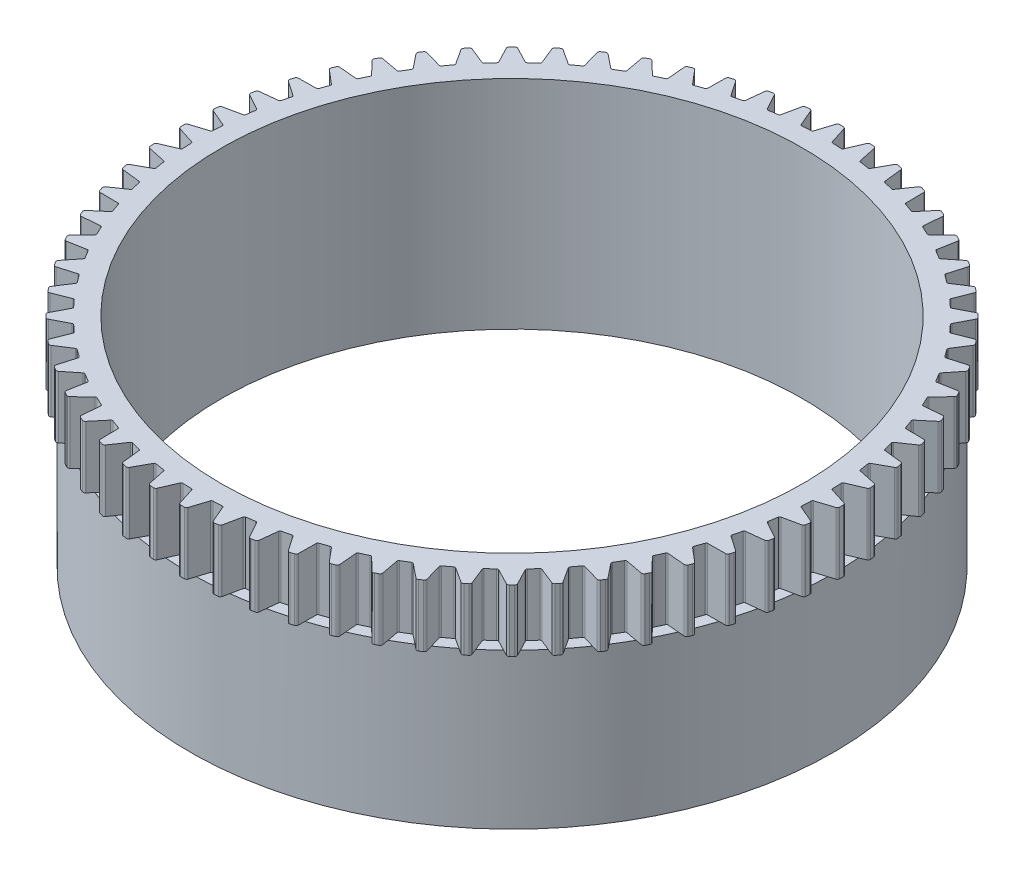
from build123d import *

# Parameters (mm, degrees)
BOSS_EXTRUDE1_DEPTH     = 8
SKETCH2_R               = 41.5
BOSS_EXTRUDE2_DEPTH     = 20
CUT_EXTRUDE1_DEPTH      = 67.306108316
CUT_EXTRUDE1_DEPTH_BACK = 67.306108316
SKETCH3_R               = 37.5


with BuildPart() as part:
    # Sketch1 → Boss-Extrude1 (new body)
    with BuildSketch(Plane(origin=(0, 0, 0), x_dir=(1, 0, 0), z_dir=(0, 1, 0))):
        with BuildLine():
            Line((-0.516428445, 42.290788925), (-1.207230425, 40.115163336))
            ThreePointArc((-1.207230425, 40.115163336), (-1.276964086, 40.016359136), (-1.390897576, 39.975810235))
            ThreePointArc((-1.390897576, 39.975810235), (-1.962706973, 39.951818248), (-2.534114577, 39.919647585))
            ThreePointArc((-2.534114577, 39.919647585), (-2.651473934, 39.948833797), (-2.730556314, 40.040327134))
            Line((-2.730556314, 40.040327134), (-3.631280492, 42.137766057))
            ThreePointArc((-3.631280492, 42.137766057), (-3.754372708, 42.277698039), (-3.936342379, 42.317943441))
            Line((-3.936342379, 42.317943441), (-4.395114549, 42.272758326))
            ThreePointArc((-4.395114549, 42.272758326), (-4.565736235, 42.197785707), (-4.659163894, 42.036528378))
            Line((-4.659163894, 42.036528378), (-5.133390874, 39.803668586))
            ThreePointArc((-5.133390874, 39.803668586), (-5.193104244, 39.698505061), (-5.302514626, 39.646983979))
            ThreePointArc((-5.302514626, 39.646983979), (-5.869218978, 39.567060399), (-6.434721822, 39.479036907))
            ThreePointArc((-6.434721822, 39.479036907), (-6.55437681, 39.49657935), (-6.642046302, 39.579880693))
            Line((-6.642046302, 39.579880693), (-7.744018213, 41.578933466))
            ThreePointArc((-7.744018213, 41.578933466), (-7.880233439, 41.706126491), (-8.065271615, 41.728341953))
            Line((-8.065271615, 41.728341953), (-8.517405756, 41.638406881))
            ThreePointArc((-8.517405756, 41.638406881), (-8.679857251, 41.547071426), (-8.757029047, 41.377433083))
            Line((-8.757029047, 41.377433083), (-9.010113964, 39.108842749))
            ThreePointArc((-9.010113964, 39.108842749), (-9.059231969, 38.998332681), (-9.163065561, 38.936335594))
            ThreePointArc((-9.163065561, 38.936335594), (-9.719207196, 38.801250128), (-10.273359178, 38.658221521))
            ThreePointArc((-10.273359178, 38.658221521), (-10.394157455, 38.663951254), (-10.489569754, 38.738258365))
            Line((-10.489569754, 38.738258365), (-11.782176804, 40.619673017))
            ThreePointArc((-11.782176804, 40.619673017), (-11.930203214, 40.732902146), (-12.116527877, 40.736873722))
            Line((-12.116527877, 40.736873722), (-12.55766969, 40.603054816))
            ThreePointArc((-12.55766969, 40.603054816), (-12.710386496, 40.496236135), (-12.770559223, 40.319850488))
            Line((-12.770559223, 40.319850488), (-12.80006473, 38.037377376))
            ThreePointArc((-12.80006473, 38.037377376), (-12.838114338, 37.922585038), (-12.935371166, 37.850709013))
            ThreePointArc((-12.935371166, 37.850709013), (-13.475594136, 37.661762607), (-14.01305847, 37.46510633))
            ThreePointArc((-14.01305847, 37.46510633), (-14.133836682, 37.458968171), (-14.236072915, 37.523565432))
            Line((-14.236072915, 37.523565432), (-15.706866593, 39.269222912))
            ThreePointArc((-15.706866593, 39.269222912), (-15.86527861, 39.367397686), (-16.051095352, 39.353087127))
            Line((-16.051095352, 39.353087127), (-16.476996399, 39.176673137))
            ThreePointArc((-16.476996399, 39.176673137), (-16.618507771, 39.055399952), (-16.661101934, 38.873965692))
            Line((-16.661101934, 38.873965692), (-16.466743876, 36.599591267))
            ThreePointArc((-16.466743876, 36.599591267), (-16.493358648, 36.481622172), (-16.583102075, 36.400559413))
            ThreePointArc((-16.583102075, 36.400559413), (-17.102203737, 36.159571725), (-17.617804348, 35.911181684))
            ThreePointArc((-17.617804348, 35.911181684), (-17.737399335, 35.893234747), (-17.845474911, 35.947500052))
            Line((-17.845474911, 35.947500052), (-19.48029067, 37.540588723))
            ThreePointArc((-19.48029067, 37.540588723), (-19.647562701, 37.622763666), (-19.831082004, 37.59030879))
            Line((-19.831082004, 37.59030879), (-20.237640627, 37.372998679))
            ThreePointArc((-20.237640627, 37.372998679), (-20.366583731, 37.238438918), (-20.391189124, 37.053703355))
            Line((-20.391189124, 37.053703355), (-19.974839276, 34.809331086))
            ThreePointArc((-19.974839276, 34.809331086), (-19.989762898, 34.68932134), (-20.071128646, 34.599852527))
            ThreePointArc((-20.071128646, 34.599852527), (-20.564109768, 34.3091444), (-21.052881139, 34.011412728))
            ThreePointArc((-21.052881139, 34.011412728), (-21.170141136, 33.981829851), (-21.283015229, 34.025240595))
            Line((-21.283015229, 34.025240595), (-23.066108899, 35.450418143))
            ThreePointArc((-23.066108899, 35.450418143), (-23.240630022, 35.515801865), (-23.420084495, 35.465515232))
            Line((-23.420084495, 35.465515232), (-23.803385311, 35.209401814))
            ThreePointArc((-23.803385311, 35.209401814), (-23.918518357, 35.062851361), (-23.924898017, 34.8765936))
            Line((-23.924898017, 34.8765936), (-23.290566055, 32.683838018))
            ThreePointArc((-23.290566055, 32.683838018), (-23.293654803, 32.562943381), (-23.365859276, 32.465930147))
            ThreePointArc((-23.365859276, 32.465930147), (-23.82797218, 32.128301259), (-24.285207176, 31.784095274))
            ThreePointArc((-24.285207176, 31.784095274), (-24.399002905, 31.743161358), (-24.515588475, 31.775299471))
            Line((-24.515588475, 31.775299471), (-26.42978789, 33.018840657))
            ThreePointArc((-26.42978789, 33.018840657), (-26.609877371, 33.066803477), (-26.78353877, 32.999169373))
            Line((-26.78353877, 32.999169373), (-27.139890384, 32.706719162))
            ThreePointArc((-27.139890384, 32.706719162), (-27.240104575, 32.549589378), (-27.228197062, 32.363603183))
            Line((-27.228197062, 32.363603183), (-26.381991951, 30.243581723))
            ThreePointArc((-26.381991951, 30.243581723), (-26.37321608, 30.122966477), (-26.435563908, 30.019343112))
            ThreePointArc((-26.435563908, 30.019343112), (-26.862358194, 29.638045014), (-27.283653392, 29.250679609))
            ThreePointArc((-27.283653392, 29.250679609), (-27.392888939, 29.198788868), (-27.512063203, 29.219344843))
            Line((-27.512063203, 29.219344843), (-29.538933575, 30.269273686))
            ThreePointArc((-29.538933575, 30.269273686), (-29.722857055, 30.299353696), (-29.889052926, 30.215023475))
            Line((-29.889052926, 30.215023475), (-30.215023475, 29.889052926))
            ThreePointArc((-30.215023475, 29.889052926), (-30.299353696, 29.722857055), (-30.269273686, 29.538933575))
            Line((-30.269273686, 29.538933575), (-29.219344843, 27.512063203))
            ThreePointArc((-29.219344843, 27.512063203), (-29.198788868, 27.392888939), (-29.250679609, 27.283653392))
            ThreePointArc((-29.250679609, 27.283653392), (-29.638045014, 26.862358194), (-30.019343112, 26.435563908))
            ThreePointArc((-30.019343112, 26.435563908), (-30.122966477, 26.37321608), (-30.243581723, 26.381991951))
            Line((-30.243581723, 26.381991951), (-32.363603183, 27.228197062))
            ThreePointArc((-32.363603183, 27.228197062), (-32.549589378, 27.240104575), (-32.706719162, 27.139890384))
            Line((-32.706719162, 27.139890384), (-32.999169373, 26.78353877))
            ThreePointArc((-32.999169373, 26.78353877), (-33.066803477, 26.609877371), (-33.018840657, 26.42978789))
            Line((-33.018840657, 26.42978789), (-31.775299471, 24.515588475))
            ThreePointArc((-31.775299471, 24.515588475), (-31.743161358, 24.399002905), (-31.784095274, 24.285207176))
            ThreePointArc((-31.784095274, 24.285207176), (-32.128301259, 23.82797218), (-32.465930147, 23.365859276))
            ThreePointArc((-32.465930147, 23.365859276), (-32.562943381, 23.293654803), (-32.683838018, 23.290566055))
            Line((-32.683838018, 23.290566055), (-34.8765936, 23.924898017))
            ThreePointArc((-34.8765936, 23.924898017), (-35.062851361, 23.918518357), (-35.209401814, 23.803385311))
            Line((-35.209401814, 23.803385311), (-35.465515232, 23.420084495))
            ThreePointArc((-35.465515232, 23.420084495), (-35.515801865, 23.240630022), (-35.450418143, 23.066108899))
            Line((-35.450418143, 23.066108899), (-34.025240595, 21.283015229))
            ThreePointArc((-34.025240595, 21.283015229), (-33.981829851, 21.170141136), (-34.011412728, 21.052881139))
            ThreePointArc((-34.011412728, 21.052881139), (-34.3091444, 20.564109768), (-34.599852527, 20.071128646))
            ThreePointArc((-34.599852527, 20.071128646), (-34.68932134, 19.989762898), (-34.809331086, 19.974839276))
            Line((-34.809331086, 19.974839276), (-37.053703355, 20.391189124))
            ThreePointArc((-37.053703355, 20.391189124), (-37.238438918, 20.366583731), (-37.372998679, 20.237640627))
            Line((-37.372998679, 20.237640627), (-37.59030879, 19.831082004))
            ThreePointArc((-37.59030879, 19.831082004), (-37.622763666, 19.647562701), (-37.540588723, 19.48029067))
            Line((-37.540588723, 19.48029067), (-35.947500052, 17.845474911))
            ThreePointArc((-35.947500052, 17.845474911), (-35.893234747, 17.737399335), (-35.911181684, 17.617804348))
            ThreePointArc((-35.911181684, 17.617804348), (-36.159571725, 17.102203737), (-36.400559413, 16.583102075))
            ThreePointArc((-36.400559413, 16.583102075), (-36.481622172, 16.493358648), (-36.599591267, 16.466743876))
            Line((-36.599591267, 16.466743876), (-38.873965692, 16.661101934))
            ThreePointArc((-38.873965692, 16.661101934), (-39.055399952, 16.618507771), (-39.176673137, 16.476996399))
            Line((-39.176673137, 16.476996399), (-39.353087127, 16.051095352))
            ThreePointArc((-39.353087127, 16.051095352), (-39.367397686, 15.86527861), (-39.269222912, 15.706866593))
            Line((-39.269222912, 15.706866593), (-37.523565432, 14.236072915))
            ThreePointArc((-37.523565432, 14.236072915), (-37.458968171, 14.133836682), (-37.46510633, 14.01305847))
            ThreePointArc((-37.46510633, 14.01305847), (-37.661762607, 13.475594136), (-37.850709013, 12.935371166))
            ThreePointArc((-37.850709013, 12.935371166), (-37.922585038, 12.838114338), (-38.037377376, 12.80006473))
            Line((-38.037377376, 12.80006473), (-40.319850488, 12.770559223))
            ThreePointArc((-40.319850488, 12.770559223), (-40.496236135, 12.710386496), (-40.603054816, 12.55766969))
            Line((-40.603054816, 12.55766969), (-40.736873722, 12.116527877))
            ThreePointArc((-40.736873722, 12.116527877), (-40.732902146, 11.930203214), (-40.619673017, 11.782176804))
            Line((-40.619673017, 11.782176804), (-38.738258365, 10.489569754))
            ThreePointArc((-38.738258365, 10.489569754), (-38.663951254, 10.394157455), (-38.658221521, 10.273359178))
            ThreePointArc((-38.658221521, 10.273359178), (-38.801250128, 9.719207196), (-38.936335594, 9.163065561))
            ThreePointArc((-38.936335594, 9.163065561), (-38.998332681, 9.059231969), (-39.108842749, 9.010113964))
            Line((-39.108842749, 9.010113964), (-41.377433083, 8.757029047))
            ThreePointArc((-41.377433083, 8.757029047), (-41.547071426, 8.679857251), (-41.638406881, 8.517405756))
            Line((-41.638406881, 8.517405756), (-41.728341953, 8.065271615))
            ThreePointArc((-41.728341953, 8.065271615), (-41.706126491, 7.880233439), (-41.578933466, 7.744018213))
            Line((-41.578933466, 7.744018213), (-39.579880693, 6.642046302))
            ThreePointArc((-39.579880693, 6.642046302), (-39.49657935, 6.55437681), (-39.479036907, 6.434721822))
            ThreePointArc((-39.479036907, 6.434721822), (-39.567060399, 5.869218978), (-39.646983979, 5.302514626))
            ThreePointArc((-39.646983979, 5.302514626), (-39.698505061, 5.193104244), (-39.803668586, 5.133390874))
            Line((-39.803668586, 5.133390874), (-42.036528378, 4.659163894))
            ThreePointArc((-42.036528378, 4.659163894), (-42.197785707, 4.565736235), (-42.272758326, 4.395114549))
            Line((-42.272758326, 4.395114549), (-42.317943441, 3.936342379))
            ThreePointArc((-42.317943441, 3.936342379), (-42.277698039, 3.754372708), (-42.137766057, 3.631280492))
            Line((-42.137766057, 3.631280492), (-40.040327134, 2.730556314))
            ThreePointArc((-40.040327134, 2.730556314), (-39.948833797, 2.651473934), (-39.919647585, 2.534114577))
            ThreePointArc((-39.919647585, 2.534114577), (-39.951818248, 1.962706973), (-39.975810235, 1.390897576))
            ThreePointArc((-39.975810235, 1.390897576), (-40.016359136, 1.276964086), (-40.115163336, 1.207230425))
            Line((-40.115163336, 1.207230425), (-42.290788925, 0.516428445))
            ThreePointArc((-42.290788925, 0.516428445), (-42.442112244, 0.407644684), (-42.5, 0.230495986))
            Line((-42.5, 0.230495986), (-42.5, -0.230495986))
            ThreePointArc((-42.5, -0.230495986), (-42.442112244, -0.407644684), (-42.290788925, -0.516428445))
            Line((-42.290788925, -0.516428445), (-40.115163336, -1.207230425))
            ThreePointArc((-40.115163336, -1.207230425), (-40.016359136, -1.276964086), (-39.975810235, -1.390897576))
            ThreePointArc((-39.975810235, -1.390897576), (-39.951818248, -1.962706973), (-39.919647585, -2.534114577))
            ThreePointArc((-39.919647585, -2.534114577), (-39.948833797, -2.651473934), (-40.040327134, -2.730556314))
            Line((-40.040327134, -2.730556314), (-42.137766057, -3.631280492))
            ThreePointArc((-42.137766057, -3.631280492), (-42.277698039, -3.754372708), (-42.317943441, -3.936342379))
            Line((-42.317943441, -3.936342379), (-42.272758326, -4.395114549))
            ThreePointArc((-42.272758326, -4.395114549), (-42.197785707, -4.565736235), (-42.036528378, -4.659163894))
            Line((-42.036528378, -4.659163894), (-39.803668586, -5.133390874))
            ThreePointArc((-39.803668586, -5.133390874), (-39.698505061, -5.193104244), (-39.646983979, -5.302514626))
            ThreePointArc((-39.646983979, -5.302514626), (-39.567060399, -5.869218978), (-39.479036907, -6.434721822))
            ThreePointArc((-39.479036907, -6.434721822), (-39.49657935, -6.55437681), (-39.579880693, -6.642046302))
            Line((-39.579880693, -6.642046302), (-41.578933466, -7.744018213))
            ThreePointArc((-41.578933466, -7.744018213), (-41.706126491, -7.880233439), (-41.728341953, -8.065271615))
            Line((-41.728341953, -8.065271615), (-41.638406881, -8.517405756))
            ThreePointArc((-41.638406881, -8.517405756), (-41.547071426, -8.679857251), (-41.377433083, -8.757029047))
            Line((-41.377433083, -8.757029047), (-39.108842749, -9.010113964))
            ThreePointArc((-39.108842749, -9.010113964), (-38.998332681, -9.059231969), (-38.936335594, -9.163065561))
            ThreePointArc((-38.936335594, -9.163065561), (-38.801250128, -9.719207196), (-38.658221521, -10.273359178))
            ThreePointArc((-38.658221521, -10.273359178), (-38.663951254, -10.394157455), (-38.738258365, -10.489569754))
            Line((-38.738258365, -10.489569754), (-40.619673017, -11.782176804))
            ThreePointArc((-40.619673017, -11.782176804), (-40.732902146, -11.930203214), (-40.736873722, -12.116527877))
            Line((-40.736873722, -12.116527877), (-40.603054816, -12.55766969))
            ThreePointArc((-40.603054816, -12.55766969), (-40.496236135, -12.710386496), (-40.319850488, -12.770559223))
            Line((-40.319850488, -12.770559223), (-38.037377376, -12.80006473))
            ThreePointArc((-38.037377376, -12.80006473), (-37.922585038, -12.838114338), (-37.850709013, -12.935371166))
            ThreePointArc((-37.850709013, -12.935371166), (-37.661762607, -13.475594136), (-37.46510633, -14.01305847))
            ThreePointArc((-37.46510633, -14.01305847), (-37.458968171, -14.133836682), (-37.523565432, -14.236072915))
            Line((-37.523565432, -14.236072915), (-39.269222912, -15.706866593))
            ThreePointArc((-39.269222912, -15.706866593), (-39.367397686, -15.86527861), (-39.353087127, -16.051095352))
            Line((-39.353087127, -16.051095352), (-39.176673137, -16.476996399))
            ThreePointArc((-39.176673137, -16.476996399), (-39.055399952, -16.618507771), (-38.873965692, -16.661101934))
            Line((-38.873965692, -16.661101934), (-36.599591267, -16.466743876))
            ThreePointArc((-36.599591267, -16.466743876), (-36.481622172, -16.493358648), (-36.400559413, -16.583102075))
            ThreePointArc((-36.400559413, -16.583102075), (-36.159571725, -17.102203737), (-35.911181684, -17.617804348))
            ThreePointArc((-35.911181684, -17.617804348), (-35.893234747, -17.737399335), (-35.947500052, -17.845474911))
            Line((-35.947500052, -17.845474911), (-37.540588723, -19.48029067))
            ThreePointArc((-37.540588723, -19.48029067), (-37.622763666, -19.647562701), (-37.59030879, -19.831082004))
            Line((-37.59030879, -19.831082004), (-37.372998679, -20.237640627))
            ThreePointArc((-37.372998679, -20.237640627), (-37.238438918, -20.366583731), (-37.053703355, -20.391189124))
            Line((-37.053703355, -20.391189124), (-34.809331086, -19.974839276))
            ThreePointArc((-34.809331086, -19.974839276), (-34.68932134, -19.989762898), (-34.599852527, -20.071128646))
            ThreePointArc((-34.599852527, -20.071128646), (-34.3091444, -20.564109768), (-34.011412728, -21.052881139))
            ThreePointArc((-34.011412728, -21.052881139), (-33.981829851, -21.170141136), (-34.025240595, -21.283015229))
            Line((-34.025240595, -21.283015229), (-35.450418143, -23.066108899))
            ThreePointArc((-35.450418143, -23.066108899), (-35.515801865, -23.240630022), (-35.465515232, -23.420084495))
            Line((-35.465515232, -23.420084495), (-35.209401814, -23.803385311))
            ThreePointArc((-35.209401814, -23.803385311), (-35.062851361, -23.918518357), (-34.8765936, -23.924898017))
            Line((-34.8765936, -23.924898017), (-32.683838018, -23.290566055))
            ThreePointArc((-32.683838018, -23.290566055), (-32.562943381, -23.293654803), (-32.465930147, -23.365859276))
            ThreePointArc((-32.465930147, -23.365859276), (-32.128301259, -23.82797218), (-31.784095274, -24.285207176))
            ThreePointArc((-31.784095274, -24.285207176), (-31.743161358, -24.399002905), (-31.775299471, -24.515588475))
            Line((-31.775299471, -24.515588475), (-33.018840657, -26.42978789))
            ThreePointArc((-33.018840657, -26.42978789), (-33.066803477, -26.609877371), (-32.999169373, -26.78353877))
            Line((-32.999169373, -26.78353877), (-32.706719162, -27.139890384))
            ThreePointArc((-32.706719162, -27.139890384), (-32.549589378, -27.240104575), (-32.363603183, -27.228197062))
            Line((-32.363603183, -27.228197062), (-30.243581723, -26.381991951))
            ThreePointArc((-30.243581723, -26.381991951), (-30.122966477, -26.37321608), (-30.019343112, -26.435563908))
            ThreePointArc((-30.019343112, -26.435563908), (-29.638045014, -26.862358194), (-29.250679609, -27.283653392))
            ThreePointArc((-29.250679609, -27.283653392), (-29.198788868, -27.392888939), (-29.219344843, -27.512063203))
            Line((-29.219344843, -27.512063203), (-30.269273686, -29.538933575))
            ThreePointArc((-30.269273686, -29.538933575), (-30.299353696, -29.722857055), (-30.215023475, -29.889052926))
            Line((-30.215023475, -29.889052926), (-29.889052926, -30.215023475))
            ThreePointArc((-29.889052926, -30.215023475), (-29.722857055, -30.299353696), (-29.538933575, -30.269273686))
            Line((-29.538933575, -30.269273686), (-27.512063203, -29.219344843))
            ThreePointArc((-27.512063203, -29.219344843), (-27.392888939, -29.198788868), (-27.283653392, -29.250679609))
            ThreePointArc((-27.283653392, -29.250679609), (-26.862358194, -29.638045014), (-26.435563908, -30.019343112))
            ThreePointArc((-26.435563908, -30.019343112), (-26.37321608, -30.122966477), (-26.381991951, -30.243581723))
            Line((-26.381991951, -30.243581723), (-27.228197062, -32.363603183))
            ThreePointArc((-27.228197062, -32.363603183), (-27.240104575, -32.549589378), (-27.139890384, -32.706719162))
            Line((-27.139890384, -32.706719162), (-26.78353877, -32.999169373))
            ThreePointArc((-26.78353877, -32.999169373), (-26.609877371, -33.066803477), (-26.42978789, -33.018840657))
            Line((-26.42978789, -33.018840657), (-24.515588475, -31.775299471))
            ThreePointArc((-24.515588475, -31.775299471), (-24.399002905, -31.743161358), (-24.285207176, -31.784095274))
            ThreePointArc((-24.285207176, -31.784095274), (-23.82797218, -32.128301259), (-23.365859276, -32.465930147))
            ThreePointArc((-23.365859276, -32.465930147), (-23.293654803, -32.562943381), (-23.290566055, -32.683838018))
            Line((-23.290566055, -32.683838018), (-23.924898017, -34.8765936))
            ThreePointArc((-23.924898017, -34.8765936), (-23.918518357, -35.062851361), (-23.803385311, -35.209401814))
            Line((-23.803385311, -35.209401814), (-23.420084495, -35.465515232))
            ThreePointArc((-23.420084495, -35.465515232), (-23.240630022, -35.515801865), (-23.066108899, -35.450418143))
            Line((-23.066108899, -35.450418143), (-21.283015229, -34.025240595))
            ThreePointArc((-21.283015229, -34.025240595), (-21.170141136, -33.981829851), (-21.052881139, -34.011412728))
            ThreePointArc((-21.052881139, -34.011412728), (-20.564109768, -34.3091444), (-20.071128646, -34.599852527))
            ThreePointArc((-20.071128646, -34.599852527), (-19.989762898, -34.68932134), (-19.974839276, -34.809331086))
            Line((-19.974839276, -34.809331086), (-20.391189124, -37.053703355))
            ThreePointArc((-20.391189124, -37.053703355), (-20.366583731, -37.238438918), (-20.237640627, -37.372998679))
            Line((-20.237640627, -37.372998679), (-19.831082004, -37.59030879))
            ThreePointArc((-19.831082004, -37.59030879), (-19.647562701, -37.622763666), (-19.48029067, -37.540588723))
            Line((-19.48029067, -37.540588723), (-17.845474911, -35.947500052))
            ThreePointArc((-17.845474911, -35.947500052), (-17.737399335, -35.893234747), (-17.617804348, -35.911181684))
            ThreePointArc((-17.617804348, -35.911181684), (-17.102203737, -36.159571725), (-16.583102075, -36.400559413))
            ThreePointArc((-16.583102075, -36.400559413), (-16.493358648, -36.481622172), (-16.466743876, -36.599591267))
            Line((-16.466743876, -36.599591267), (-16.661101934, -38.873965692))
            ThreePointArc((-16.661101934, -38.873965692), (-16.618507771, -39.055399952), (-16.476996399, -39.176673137))
            Line((-16.476996399, -39.176673137), (-16.051095352, -39.353087127))
            ThreePointArc((-16.051095352, -39.353087127), (-15.86527861, -39.367397686), (-15.706866593, -39.269222912))
            Line((-15.706866593, -39.269222912), (-14.236072915, -37.523565432))
            ThreePointArc((-14.236072915, -37.523565432), (-14.133836682, -37.458968171), (-14.01305847, -37.46510633))
            ThreePointArc((-14.01305847, -37.46510633), (-13.475594136, -37.661762607), (-12.935371166, -37.850709013))
            ThreePointArc((-12.935371166, -37.850709013), (-12.838114338, -37.922585038), (-12.80006473, -38.037377376))
            Line((-12.80006473, -38.037377376), (-12.770559223, -40.319850488))
            ThreePointArc((-12.770559223, -40.319850488), (-12.710386496, -40.496236135), (-12.55766969, -40.603054816))
            Line((-12.55766969, -40.603054816), (-12.116527877, -40.736873722))
            ThreePointArc((-12.116527877, -40.736873722), (-11.930203214, -40.732902146), (-11.782176804, -40.619673017))
            Line((-11.782176804, -40.619673017), (-10.489569754, -38.738258365))
            ThreePointArc((-10.489569754, -38.738258365), (-10.394157455, -38.663951254), (-10.273359178, -38.658221521))
            ThreePointArc((-10.273359178, -38.658221521), (-9.719207196, -38.801250128), (-9.163065561, -38.936335594))
            ThreePointArc((-9.163065561, -38.936335594), (-9.059231969, -38.998332681), (-9.010113964, -39.108842749))
            Line((-9.010113964, -39.108842749), (-8.757029047, -41.377433083))
            ThreePointArc((-8.757029047, -41.377433083), (-8.679857251, -41.547071426), (-8.517405756, -41.638406881))
            Line((-8.517405756, -41.638406881), (-8.065271615, -41.728341953))
            ThreePointArc((-8.065271615, -41.728341953), (-7.880233439, -41.706126491), (-7.744018213, -41.578933466))
            Line((-7.744018213, -41.578933466), (-6.642046302, -39.579880693))
            ThreePointArc((-6.642046302, -39.579880693), (-6.55437681, -39.49657935), (-6.434721822, -39.479036907))
            ThreePointArc((-6.434721822, -39.479036907), (-5.869218978, -39.567060399), (-5.302514626, -39.646983979))
            ThreePointArc((-5.302514626, -39.646983979), (-5.193104244, -39.698505061), (-5.133390874, -39.803668586))
            Line((-5.133390874, -39.803668586), (-4.659163894, -42.036528378))
            ThreePointArc((-4.659163894, -42.036528378), (-4.565736235, -42.197785707), (-4.395114549, -42.272758326))
            Line((-4.395114549, -42.272758326), (-3.936342379, -42.317943441))
            ThreePointArc((-3.936342379, -42.317943441), (-3.754372708, -42.277698039), (-3.631280492, -42.137766057))
            Line((-3.631280492, -42.137766057), (-2.730556314, -40.040327134))
            ThreePointArc((-2.730556314, -40.040327134), (-2.651473934, -39.948833797), (-2.534114577, -39.919647585))
            ThreePointArc((-2.534114577, -39.919647585), (-1.962706973, -39.951818248), (-1.390897576, -39.975810235))
            ThreePointArc((-1.390897576, -39.975810235), (-1.276964086, -40.016359136), (-1.207230425, -40.115163336))
            Line((-1.207230425, -40.115163336), (-0.516428445, -42.290788925))
            ThreePointArc((-0.516428445, -42.290788925), (-0.407644684, -42.442112244), (-0.230495986, -42.5))
            Line((-0.230495986, -42.5), (0.230495986, -42.5))
            ThreePointArc((0.230495986, -42.5), (0.407644684, -42.442112244), (0.516428445, -42.290788925))
            Line((0.516428445, -42.290788925), (1.207230425, -40.115163336))
            ThreePointArc((1.207230425, -40.115163336), (1.276964086, -40.016359136), (1.390897576, -39.975810235))
            ThreePointArc((1.390897576, -39.975810235), (1.962706973, -39.951818248), (2.534114577, -39.919647585))
            ThreePointArc((2.534114577, -39.919647585), (2.651473934, -39.948833797), (2.730556314, -40.040327134))
            Line((2.730556314, -40.040327134), (3.631280492, -42.137766057))
            ThreePointArc((3.631280492, -42.137766057), (3.754372708, -42.277698039), (3.936342379, -42.317943441))
            Line((3.936342379, -42.317943441), (4.395114549, -42.272758326))
            ThreePointArc((4.395114549, -42.272758326), (4.565736235, -42.197785707), (4.659163894, -42.036528378))
            Line((4.659163894, -42.036528378), (5.133390874, -39.803668586))
            ThreePointArc((5.133390874, -39.803668586), (5.193104244, -39.698505061), (5.302514626, -39.646983979))
            ThreePointArc((5.302514626, -39.646983979), (5.869218978, -39.567060399), (6.434721822, -39.479036907))
            ThreePointArc((6.434721822, -39.479036907), (6.55437681, -39.49657935), (6.642046302, -39.579880693))
            Line((6.642046302, -39.579880693), (7.744018213, -41.578933466))
            ThreePointArc((7.744018213, -41.578933466), (7.880233439, -41.706126491), (8.065271615, -41.728341953))
            Line((8.065271615, -41.728341953), (8.517405756, -41.638406881))
            ThreePointArc((8.517405756, -41.638406881), (8.679857251, -41.547071426), (8.757029047, -41.377433083))
            Line((8.757029047, -41.377433083), (9.010113964, -39.108842749))
            ThreePointArc((9.010113964, -39.108842749), (9.059231969, -38.998332681), (9.163065561, -38.936335594))
            ThreePointArc((9.163065561, -38.936335594), (9.719207196, -38.801250128), (10.273359178, -38.658221521))
            ThreePointArc((10.273359178, -38.658221521), (10.394157455, -38.663951254), (10.489569754, -38.738258365))
            Line((10.489569754, -38.738258365), (11.782176804, -40.619673017))
            ThreePointArc((11.782176804, -40.619673017), (11.930203214, -40.732902146), (12.116527877, -40.736873722))
            Line((12.116527877, -40.736873722), (12.55766969, -40.603054816))
            ThreePointArc((12.55766969, -40.603054816), (12.710386496, -40.496236135), (12.770559223, -40.319850488))
            Line((12.770559223, -40.319850488), (12.80006473, -38.037377376))
            ThreePointArc((12.80006473, -38.037377376), (12.838114338, -37.922585038), (12.935371166, -37.850709013))
            ThreePointArc((12.935371166, -37.850709013), (13.475594136, -37.661762607), (14.01305847, -37.46510633))
            ThreePointArc((14.01305847, -37.46510633), (14.133836682, -37.458968171), (14.236072915, -37.523565432))
            Line((14.236072915, -37.523565432), (15.706866593, -39.269222912))
            ThreePointArc((15.706866593, -39.269222912), (15.86527861, -39.367397686), (16.051095352, -39.353087127))
            Line((16.051095352, -39.353087127), (16.476996399, -39.176673137))
            ThreePointArc((16.476996399, -39.176673137), (16.618507771, -39.055399952), (16.661101934, -38.873965692))
            Line((16.661101934, -38.873965692), (16.466743876, -36.599591267))
            ThreePointArc((16.466743876, -36.599591267), (16.493358648, -36.481622172), (16.583102075, -36.400559413))
            ThreePointArc((16.583102075, -36.400559413), (17.102203737, -36.159571725), (17.617804348, -35.911181684))
            ThreePointArc((17.617804348, -35.911181684), (17.737399335, -35.893234747), (17.845474911, -35.947500052))
            Line((17.845474911, -35.947500052), (19.48029067, -37.540588723))
            ThreePointArc((19.48029067, -37.540588723), (19.647562701, -37.622763666), (19.831082004, -37.59030879))
            Line((19.831082004, -37.59030879), (20.237640627, -37.372998679))
            ThreePointArc((20.237640627, -37.372998679), (20.366583731, -37.238438918), (20.391189124, -37.053703355))
            Line((20.391189124, -37.053703355), (19.974839276, -34.809331086))
            ThreePointArc((19.974839276, -34.809331086), (19.989762898, -34.68932134), (20.071128646, -34.599852527))
            ThreePointArc((20.071128646, -34.599852527), (20.564109768, -34.3091444), (21.052881139, -34.011412728))
            ThreePointArc((21.052881139, -34.011412728), (21.170141136, -33.981829851), (21.283015229, -34.025240595))
            Line((21.283015229, -34.025240595), (23.066108899, -35.450418143))
            ThreePointArc((23.066108899, -35.450418143), (23.240630022, -35.515801865), (23.420084495, -35.465515232))
            Line((23.420084495, -35.465515232), (23.803385311, -35.209401814))
            ThreePointArc((23.803385311, -35.209401814), (23.918518357, -35.062851361), (23.924898017, -34.8765936))
            Line((23.924898017, -34.8765936), (23.290566055, -32.683838018))
            ThreePointArc((23.290566055, -32.683838018), (23.293654803, -32.562943381), (23.365859276, -32.465930147))
            ThreePointArc((23.365859276, -32.465930147), (23.82797218, -32.128301259), (24.285207176, -31.784095274))
            ThreePointArc((24.285207176, -31.784095274), (24.399002905, -31.743161358), (24.515588475, -31.775299471))
            Line((24.515588475, -31.775299471), (26.42978789, -33.018840657))
            ThreePointArc((26.42978789, -33.018840657), (26.609877371, -33.066803477), (26.78353877, -32.999169373))
            Line((26.78353877, -32.999169373), (27.139890384, -32.706719162))
            ThreePointArc((27.139890384, -32.706719162), (27.240104575, -32.549589378), (27.228197062, -32.363603183))
            Line((27.228197062, -32.363603183), (26.381991951, -30.243581723))
            ThreePointArc((26.381991951, -30.243581723), (26.37321608, -30.122966477), (26.435563908, -30.019343112))
            ThreePointArc((26.435563908, -30.019343112), (26.862358194, -29.638045014), (27.283653392, -29.250679609))
            ThreePointArc((27.283653392, -29.250679609), (27.392888939, -29.198788868), (27.512063203, -29.219344843))
            Line((27.512063203, -29.219344843), (29.538933575, -30.269273686))
            ThreePointArc((29.538933575, -30.269273686), (29.722857055, -30.299353696), (29.889052926, -30.215023475))
            Line((29.889052926, -30.215023475), (30.215023475, -29.889052926))
            ThreePointArc((30.215023475, -29.889052926), (30.299353696, -29.722857055), (30.269273686, -29.538933575))
            Line((30.269273686, -29.538933575), (29.219344843, -27.512063203))
            ThreePointArc((29.219344843, -27.512063203), (29.198788868, -27.392888939), (29.250679609, -27.283653392))
            ThreePointArc((29.250679609, -27.283653392), (29.638045014, -26.862358194), (30.019343112, -26.435563908))
            ThreePointArc((30.019343112, -26.435563908), (30.122966477, -26.37321608), (30.243581723, -26.381991951))
            Line((30.243581723, -26.381991951), (32.363603183, -27.228197062))
            ThreePointArc((32.363603183, -27.228197062), (32.549589378, -27.240104575), (32.706719162, -27.139890384))
            Line((32.706719162, -27.139890384), (32.999169373, -26.78353877))
            ThreePointArc((32.999169373, -26.78353877), (33.066803477, -26.609877371), (33.018840657, -26.42978789))
            Line((33.018840657, -26.42978789), (31.775299471, -24.515588475))
            ThreePointArc((31.775299471, -24.515588475), (31.743161358, -24.399002905), (31.784095274, -24.285207176))
            ThreePointArc((31.784095274, -24.285207176), (32.128301259, -23.82797218), (32.465930147, -23.365859276))
            ThreePointArc((32.465930147, -23.365859276), (32.562943381, -23.293654803), (32.683838018, -23.290566055))
            Line((32.683838018, -23.290566055), (34.8765936, -23.924898017))
            ThreePointArc((34.8765936, -23.924898017), (35.062851361, -23.918518357), (35.209401814, -23.803385311))
            Line((35.209401814, -23.803385311), (35.465515232, -23.420084495))
            ThreePointArc((35.465515232, -23.420084495), (35.515801865, -23.240630022), (35.450418143, -23.066108899))
            Line((35.450418143, -23.066108899), (34.025240595, -21.283015229))
            ThreePointArc((34.025240595, -21.283015229), (33.981829851, -21.170141136), (34.011412728, -21.052881139))
            ThreePointArc((34.011412728, -21.052881139), (34.3091444, -20.564109768), (34.599852527, -20.071128646))
            ThreePointArc((34.599852527, -20.071128646), (34.68932134, -19.989762898), (34.809331086, -19.974839276))
            Line((34.809331086, -19.974839276), (37.053703355, -20.391189124))
            ThreePointArc((37.053703355, -20.391189124), (37.238438918, -20.366583731), (37.372998679, -20.237640627))
            Line((37.372998679, -20.237640627), (37.59030879, -19.831082004))
            ThreePointArc((37.59030879, -19.831082004), (37.622763666, -19.647562701), (37.540588723, -19.48029067))
            Line((37.540588723, -19.48029067), (35.947500052, -17.845474911))
            ThreePointArc((35.947500052, -17.845474911), (35.893234747, -17.737399335), (35.911181684, -17.617804348))
            ThreePointArc((35.911181684, -17.617804348), (36.159571725, -17.102203737), (36.400559413, -16.583102075))
            ThreePointArc((36.400559413, -16.583102075), (36.481622172, -16.493358648), (36.599591267, -16.466743876))
            Line((36.599591267, -16.466743876), (38.873965692, -16.661101934))
            ThreePointArc((38.873965692, -16.661101934), (39.055399952, -16.618507771), (39.176673137, -16.476996399))
            Line((39.176673137, -16.476996399), (39.353087127, -16.051095352))
            ThreePointArc((39.353087127, -16.051095352), (39.367397686, -15.86527861), (39.269222912, -15.706866593))
            Line((39.269222912, -15.706866593), (37.523565432, -14.236072915))
            ThreePointArc((37.523565432, -14.236072915), (37.458968171, -14.133836682), (37.46510633, -14.01305847))
            ThreePointArc((37.46510633, -14.01305847), (37.661762607, -13.475594136), (37.850709013, -12.935371166))
            ThreePointArc((37.850709013, -12.935371166), (37.922585038, -12.838114338), (38.037377376, -12.80006473))
            Line((38.037377376, -12.80006473), (40.319850488, -12.770559223))
            ThreePointArc((40.319850488, -12.770559223), (40.496236135, -12.710386496), (40.603054816, -12.55766969))
            Line((40.603054816, -12.55766969), (40.736873722, -12.116527877))
            ThreePointArc((40.736873722, -12.116527877), (40.732902146, -11.930203214), (40.619673017, -11.782176804))
            Line((40.619673017, -11.782176804), (38.738258365, -10.489569754))
            ThreePointArc((38.738258365, -10.489569754), (38.663951254, -10.394157455), (38.658221521, -10.273359178))
            ThreePointArc((38.658221521, -10.273359178), (38.801250128, -9.719207196), (38.936335594, -9.163065561))
            ThreePointArc((38.936335594, -9.163065561), (38.998332681, -9.059231969), (39.108842749, -9.010113964))
            Line((39.108842749, -9.010113964), (41.377433083, -8.757029047))
            ThreePointArc((41.377433083, -8.757029047), (41.547071426, -8.679857251), (41.638406881, -8.517405756))
            Line((41.638406881, -8.517405756), (41.728341953, -8.065271615))
            ThreePointArc((41.728341953, -8.065271615), (41.706126491, -7.880233439), (41.578933466, -7.744018213))
            Line((41.578933466, -7.744018213), (39.579880693, -6.642046302))
            ThreePointArc((39.579880693, -6.642046302), (39.49657935, -6.55437681), (39.479036907, -6.434721822))
            ThreePointArc((39.479036907, -6.434721822), (39.567060399, -5.869218978), (39.646983979, -5.302514626))
            ThreePointArc((39.646983979, -5.302514626), (39.698505061, -5.193104244), (39.803668586, -5.133390874))
            Line((39.803668586, -5.133390874), (42.036528378, -4.659163894))
            ThreePointArc((42.036528378, -4.659163894), (42.197785707, -4.565736235), (42.272758326, -4.395114549))
            Line((42.272758326, -4.395114549), (42.317943441, -3.936342379))
            ThreePointArc((42.317943441, -3.936342379), (42.277698039, -3.754372708), (42.137766057, -3.631280492))
            Line((42.137766057, -3.631280492), (40.040327134, -2.730556314))
            ThreePointArc((40.040327134, -2.730556314), (39.948833797, -2.651473934), (39.919647585, -2.534114577))
            ThreePointArc((39.919647585, -2.534114577), (39.951818248, -1.962706973), (39.975810235, -1.390897576))
            ThreePointArc((39.975810235, -1.390897576), (40.016359136, -1.276964086), (40.115163336, -1.207230425))
            Line((40.115163336, -1.207230425), (42.290788925, -0.516428445))
            ThreePointArc((42.290788925, -0.516428445), (42.442112244, -0.407644684), (42.5, -0.230495986))
            Line((42.5, -0.230495986), (42.5, 0.230495986))
            ThreePointArc((42.5, 0.230495986), (42.442112244, 0.407644684), (42.290788925, 0.516428445))
            Line((42.290788925, 0.516428445), (40.115163336, 1.207230425))
            ThreePointArc((40.115163336, 1.207230425), (40.016359136, 1.276964086), (39.975810235, 1.390897576))
            ThreePointArc((39.975810235, 1.390897576), (39.951818248, 1.962706973), (39.919647585, 2.534114577))
            ThreePointArc((39.919647585, 2.534114577), (39.948833797, 2.651473934), (40.040327134, 2.730556314))
            Line((40.040327134, 2.730556314), (42.137766057, 3.631280492))
            ThreePointArc((42.137766057, 3.631280492), (42.277698039, 3.754372708), (42.317943441, 3.936342379))
            Line((42.317943441, 3.936342379), (42.272758326, 4.395114549))
            ThreePointArc((42.272758326, 4.395114549), (42.197785707, 4.565736235), (42.036528378, 4.659163894))
            Line((42.036528378, 4.659163894), (39.803668586, 5.133390874))
            ThreePointArc((39.803668586, 5.133390874), (39.698505061, 5.193104244), (39.646983979, 5.302514626))
            ThreePointArc((39.646983979, 5.302514626), (39.567060399, 5.869218978), (39.479036907, 6.434721822))
            ThreePointArc((39.479036907, 6.434721822), (39.49657935, 6.55437681), (39.579880693, 6.642046302))
            Line((39.579880693, 6.642046302), (41.578933466, 7.744018213))
            ThreePointArc((41.578933466, 7.744018213), (41.706126491, 7.880233439), (41.728341953, 8.065271615))
            Line((41.728341953, 8.065271615), (41.638406881, 8.517405756))
            ThreePointArc((41.638406881, 8.517405756), (41.547071426, 8.679857251), (41.377433083, 8.757029047))
            Line((41.377433083, 8.757029047), (39.108842749, 9.010113964))
            ThreePointArc((39.108842749, 9.010113964), (38.998332681, 9.059231969), (38.936335594, 9.163065561))
            ThreePointArc((38.936335594, 9.163065561), (38.801250128, 9.719207196), (38.658221521, 10.273359178))
            ThreePointArc((38.658221521, 10.273359178), (38.663951254, 10.394157455), (38.738258365, 10.489569754))
            Line((38.738258365, 10.489569754), (40.619673017, 11.782176804))
            ThreePointArc((40.619673017, 11.782176804), (40.732902146, 11.930203214), (40.736873722, 12.116527877))
            Line((40.736873722, 12.116527877), (40.603054816, 12.55766969))
            ThreePointArc((40.603054816, 12.55766969), (40.496236135, 12.710386496), (40.319850488, 12.770559223))
            Line((40.319850488, 12.770559223), (38.037377376, 12.80006473))
            ThreePointArc((38.037377376, 12.80006473), (37.922585038, 12.838114338), (37.850709013, 12.935371166))
            ThreePointArc((37.850709013, 12.935371166), (37.661762607, 13.475594136), (37.46510633, 14.01305847))
            ThreePointArc((37.46510633, 14.01305847), (37.458968171, 14.133836682), (37.523565432, 14.236072915))
            Line((37.523565432, 14.236072915), (39.269222912, 15.706866593))
            ThreePointArc((39.269222912, 15.706866593), (39.367397686, 15.86527861), (39.353087127, 16.051095352))
            Line((39.353087127, 16.051095352), (39.176673137, 16.476996399))
            ThreePointArc((39.176673137, 16.476996399), (39.055399952, 16.618507771), (38.873965692, 16.661101934))
            Line((38.873965692, 16.661101934), (36.599591267, 16.466743876))
            ThreePointArc((36.599591267, 16.466743876), (36.481622172, 16.493358648), (36.400559413, 16.583102075))
            ThreePointArc((36.400559413, 16.583102075), (36.159571725, 17.102203737), (35.911181684, 17.617804348))
            ThreePointArc((35.911181684, 17.617804348), (35.893234747, 17.737399335), (35.947500052, 17.845474911))
            Line((35.947500052, 17.845474911), (37.540588723, 19.48029067))
            ThreePointArc((37.540588723, 19.48029067), (37.622763666, 19.647562701), (37.59030879, 19.831082004))
            Line((37.59030879, 19.831082004), (37.372998679, 20.237640627))
            ThreePointArc((37.372998679, 20.237640627), (37.238438918, 20.366583731), (37.053703355, 20.391189124))
            Line((37.053703355, 20.391189124), (34.809331086, 19.974839276))
            ThreePointArc((34.809331086, 19.974839276), (34.68932134, 19.989762898), (34.599852527, 20.071128646))
            ThreePointArc((34.599852527, 20.071128646), (34.3091444, 20.564109768), (34.011412728, 21.052881139))
            ThreePointArc((34.011412728, 21.052881139), (33.981829851, 21.170141136), (34.025240595, 21.283015229))
            Line((34.025240595, 21.283015229), (35.450418143, 23.066108899))
            ThreePointArc((35.450418143, 23.066108899), (35.515801865, 23.240630022), (35.465515232, 23.420084495))
            Line((35.465515232, 23.420084495), (35.209401814, 23.803385311))
            ThreePointArc((35.209401814, 23.803385311), (35.062851361, 23.918518357), (34.8765936, 23.924898017))
            Line((34.8765936, 23.924898017), (32.683838018, 23.290566055))
            ThreePointArc((32.683838018, 23.290566055), (32.562943381, 23.293654803), (32.465930147, 23.365859276))
            ThreePointArc((32.465930147, 23.365859276), (32.128301259, 23.82797218), (31.784095274, 24.285207176))
            ThreePointArc((31.784095274, 24.285207176), (31.743161358, 24.399002905), (31.775299471, 24.515588475))
            Line((31.775299471, 24.515588475), (33.018840657, 26.42978789))
            ThreePointArc((33.018840657, 26.42978789), (33.066803477, 26.609877371), (32.999169373, 26.78353877))
            Line((32.999169373, 26.78353877), (32.706719162, 27.139890384))
            ThreePointArc((32.706719162, 27.139890384), (32.549589378, 27.240104575), (32.363603183, 27.228197062))
            Line((32.363603183, 27.228197062), (30.243581723, 26.381991951))
            ThreePointArc((30.243581723, 26.381991951), (30.122966477, 26.37321608), (30.019343112, 26.435563908))
            ThreePointArc((30.019343112, 26.435563908), (29.638045014, 26.862358194), (29.250679609, 27.283653392))
            ThreePointArc((29.250679609, 27.283653392), (29.198788868, 27.392888939), (29.219344843, 27.512063203))
            Line((29.219344843, 27.512063203), (30.269273686, 29.538933575))
            ThreePointArc((30.269273686, 29.538933575), (30.299353696, 29.722857055), (30.215023475, 29.889052926))
            Line((30.215023475, 29.889052926), (29.889052926, 30.215023475))
            ThreePointArc((29.889052926, 30.215023475), (29.722857055, 30.299353696), (29.538933575, 30.269273686))
            Line((29.538933575, 30.269273686), (27.512063203, 29.219344843))
            ThreePointArc((27.512063203, 29.219344843), (27.392888939, 29.198788868), (27.283653392, 29.250679609))
            ThreePointArc((27.283653392, 29.250679609), (26.862358194, 29.638045014), (26.435563908, 30.019343112))
            ThreePointArc((26.435563908, 30.019343112), (26.37321608, 30.122966477), (26.381991951, 30.243581723))
            Line((26.381991951, 30.243581723), (27.228197062, 32.363603183))
            ThreePointArc((27.228197062, 32.363603183), (27.240104575, 32.549589378), (27.139890384, 32.706719162))
            Line((27.139890384, 32.706719162), (26.78353877, 32.999169373))
            ThreePointArc((26.78353877, 32.999169373), (26.609877371, 33.066803477), (26.42978789, 33.018840657))
            Line((26.42978789, 33.018840657), (24.515588475, 31.775299471))
            ThreePointArc((24.515588475, 31.775299471), (24.399002905, 31.743161358), (24.285207176, 31.784095274))
            ThreePointArc((24.285207176, 31.784095274), (23.82797218, 32.128301259), (23.365859276, 32.465930147))
            ThreePointArc((23.365859276, 32.465930147), (23.293654803, 32.562943381), (23.290566055, 32.683838018))
            Line((23.290566055, 32.683838018), (23.924898017, 34.8765936))
            ThreePointArc((23.924898017, 34.8765936), (23.918518357, 35.062851361), (23.803385311, 35.209401814))
            Line((23.803385311, 35.209401814), (23.420084495, 35.465515232))
            ThreePointArc((23.420084495, 35.465515232), (23.240630022, 35.515801865), (23.066108899, 35.450418143))
            Line((23.066108899, 35.450418143), (21.283015229, 34.025240595))
            ThreePointArc((21.283015229, 34.025240595), (21.170141136, 33.981829851), (21.052881139, 34.011412728))
            ThreePointArc((21.052881139, 34.011412728), (20.564109768, 34.3091444), (20.071128646, 34.599852527))
            ThreePointArc((20.071128646, 34.599852527), (19.989762898, 34.68932134), (19.974839276, 34.809331086))
            Line((19.974839276, 34.809331086), (20.391189124, 37.053703355))
            ThreePointArc((20.391189124, 37.053703355), (20.366583731, 37.238438918), (20.237640627, 37.372998679))
            Line((20.237640627, 37.372998679), (19.831082004, 37.59030879))
            ThreePointArc((19.831082004, 37.59030879), (19.647562701, 37.622763666), (19.48029067, 37.540588723))
            Line((19.48029067, 37.540588723), (17.845474911, 35.947500052))
            ThreePointArc((17.845474911, 35.947500052), (17.737399335, 35.893234747), (17.617804348, 35.911181684))
            ThreePointArc((17.617804348, 35.911181684), (17.102203737, 36.159571725), (16.583102075, 36.400559413))
            ThreePointArc((16.583102075, 36.400559413), (16.493358648, 36.481622172), (16.466743876, 36.599591267))
            Line((16.466743876, 36.599591267), (16.661101934, 38.873965692))
            ThreePointArc((16.661101934, 38.873965692), (16.618507771, 39.055399952), (16.476996399, 39.176673137))
            Line((16.476996399, 39.176673137), (16.051095352, 39.353087127))
            ThreePointArc((16.051095352, 39.353087127), (15.86527861, 39.367397686), (15.706866593, 39.269222912))
            Line((15.706866593, 39.269222912), (14.236072915, 37.523565432))
            ThreePointArc((14.236072915, 37.523565432), (14.133836682, 37.458968171), (14.01305847, 37.46510633))
            ThreePointArc((14.01305847, 37.46510633), (13.475594136, 37.661762607), (12.935371166, 37.850709013))
            ThreePointArc((12.935371166, 37.850709013), (12.838114338, 37.922585038), (12.80006473, 38.037377376))
            Line((12.80006473, 38.037377376), (12.770559223, 40.319850488))
            ThreePointArc((12.770559223, 40.319850488), (12.710386496, 40.496236135), (12.55766969, 40.603054816))
            Line((12.55766969, 40.603054816), (12.116527877, 40.736873722))
            ThreePointArc((12.116527877, 40.736873722), (11.930203214, 40.732902146), (11.782176804, 40.619673017))
            Line((11.782176804, 40.619673017), (10.489569754, 38.738258365))
            ThreePointArc((10.489569754, 38.738258365), (10.394157455, 38.663951254), (10.273359178, 38.658221521))
            ThreePointArc((10.273359178, 38.658221521), (9.719207196, 38.801250128), (9.163065561, 38.936335594))
            ThreePointArc((9.163065561, 38.936335594), (9.059231969, 38.998332681), (9.010113964, 39.108842749))
            Line((9.010113964, 39.108842749), (8.757029047, 41.377433083))
            ThreePointArc((8.757029047, 41.377433083), (8.679857251, 41.547071426), (8.517405756, 41.638406881))
            Line((8.517405756, 41.638406881), (8.065271615, 41.728341953))
            ThreePointArc((8.065271615, 41.728341953), (7.880233439, 41.706126491), (7.744018213, 41.578933466))
            Line((7.744018213, 41.578933466), (6.642046302, 39.579880693))
            ThreePointArc((6.642046302, 39.579880693), (6.55437681, 39.49657935), (6.434721822, 39.479036907))
            ThreePointArc((6.434721822, 39.479036907), (5.869218978, 39.567060399), (5.302514626, 39.646983979))
            ThreePointArc((5.302514626, 39.646983979), (5.193104244, 39.698505061), (5.133390874, 39.803668586))
            Line((5.133390874, 39.803668586), (4.659163894, 42.036528378))
            ThreePointArc((4.659163894, 42.036528378), (4.565736235, 42.197785707), (4.395114549, 42.272758326))
            Line((4.395114549, 42.272758326), (3.936342379, 42.317943441))
            ThreePointArc((3.936342379, 42.317943441), (3.754372708, 42.277698039), (3.631280492, 42.137766057))
            Line((3.631280492, 42.137766057), (2.730556314, 40.040327134))
            ThreePointArc((2.730556314, 40.040327134), (2.651473934, 39.948833797), (2.534114577, 39.919647585))
            ThreePointArc((2.534114577, 39.919647585), (1.962706973, 39.951818248), (1.390897576, 39.975810235))
            ThreePointArc((1.390897576, 39.975810235), (1.276964086, 40.016359136), (1.207230425, 40.115163336))
            Line((1.207230425, 40.115163336), (0.516428445, 42.290788925))
            ThreePointArc((0.516428445, 42.290788925), (0.407644684, 42.442112244), (0.230495986, 42.5))
            Line((0.230495986, 42.5), (-0.230495986, 42.5))
            ThreePointArc((-0.230495986, 42.5), (-0.407644684, 42.442112244), (-0.516428445, 42.290788925))
        make_face()
    extrude(amount=BOSS_EXTRUDE1_DEPTH)

    # Sketch2 → Boss-Extrude2 (add)
    with BuildSketch(Plane.XZ):
        Circle(SKETCH2_R)
    extrude(amount=BOSS_EXTRUDE2_DEPTH)

    # Sketch3 → Cut-Extrude1 (cut, two sides: drawn at the far end of the back side and taken through both)
    with BuildSketch(Plane(origin=(0, 8, 0), x_dir=(1, 0, 0), z_dir=(0, 1, 0)).offset(-CUT_EXTRUDE1_DEPTH_BACK)):
        Circle(SKETCH3_R)
    extrude(amount=CUT_EXTRUDE1_DEPTH + CUT_EXTRUDE1_DEPTH_BACK, mode=Mode.SUBTRACT)


solid = part.part
